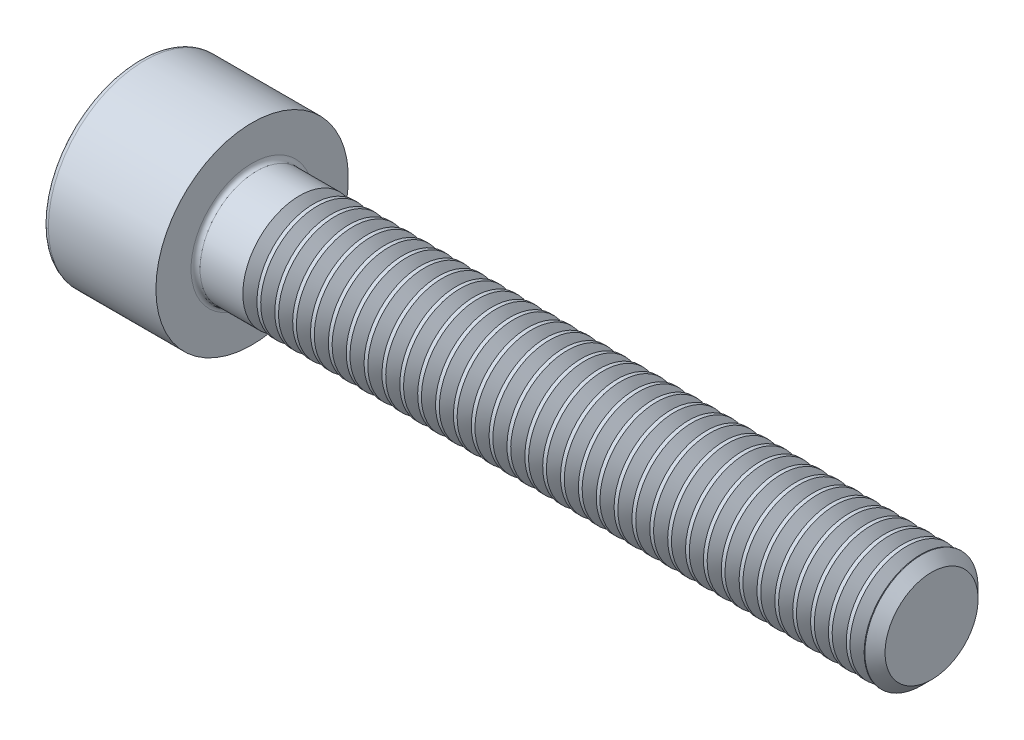
from build123d import *

# Parameters (mm, degrees)
FILLET1_R       = 0.2
FILLET2_R       = 0.25
HEX_2_DEPTH     = 2.5
THDSCHPAT_COUNT = 36
THDSCHPAT_PITCH = 0.788571429


with BuildPart() as part:
    # BodySke → Base-Revolve (revolve)
    with BuildSketch(Plane.XY):
        Polygon((0, 0), (0, 4.25), (5, 4.25), (5, 2.5), (34.555, 2.5), (35, 2.055), (35, 0), align=None)
    revolve(axis=Axis((-31.75, 0, 0), (1, 0, 0)))

    # Fillet1
    fillet1_edges = [part.edges().sort_by_distance(p)[0] for p in [
        (5, -2.5, 0),
    ]]
    fillet(fillet1_edges, radius=FILLET1_R)

    # Fillet2
    fillet2_edges = [part.edges().sort_by_distance(p)[0] for p in [
        (0, -4.25, 0),
    ]]
    fillet(fillet2_edges, radius=FILLET2_R)

    # Sketch2 → Hex-PreBroach (revolve, cut)
    with BuildSketch(Plane.XY):
        Polygon((0, 2.042), (2.5, 2.042), (3.67894925, 0), (0, 0), align=None)
    revolve(axis=Axis((0, 0, 0), (1, 0, 0)), mode=Mode.SUBTRACT)

    # Sketch3 → Hex 2 (cut)
    with BuildSketch(Plane(origin=(0, 0, 0), x_dir=(0, 0.500000000000001, 0.866025403784438), z_dir=(-1, 0, 0))):
        Polygon((1.17894925, 2.042), (-1.17894925, 2.042), (-2.357898499, 0), (-1.17894925, -2.042), (1.17894925, -2.042), (2.357898499, 0), align=None)
    extrude(amount=-HEX_2_DEPTH, mode=Mode.SUBTRACT)

    # ThdSchSke → ThreadSchematic (revolve, cut)
    with BuildSketch(Plane.XY):
        Polygon((7.4, -2.055), (7.088407645, -2.5), (7.088407645, -3.125), (7.711592355, -3.125), (7.711592355, -2.5), align=None)
    threadschematic = revolve(axis=Axis((-3.175, 0, 0), (1, 0, 0)), mode=Mode.SUBTRACT)

    # ThdSchPat: ThreadSchematic ×36
    with Locations(*[(i * THDSCHPAT_PITCH, 0, 0) for i in range(1, THDSCHPAT_COUNT)]):
        add(threadschematic, mode=Mode.SUBTRACT)


solid = part.part
